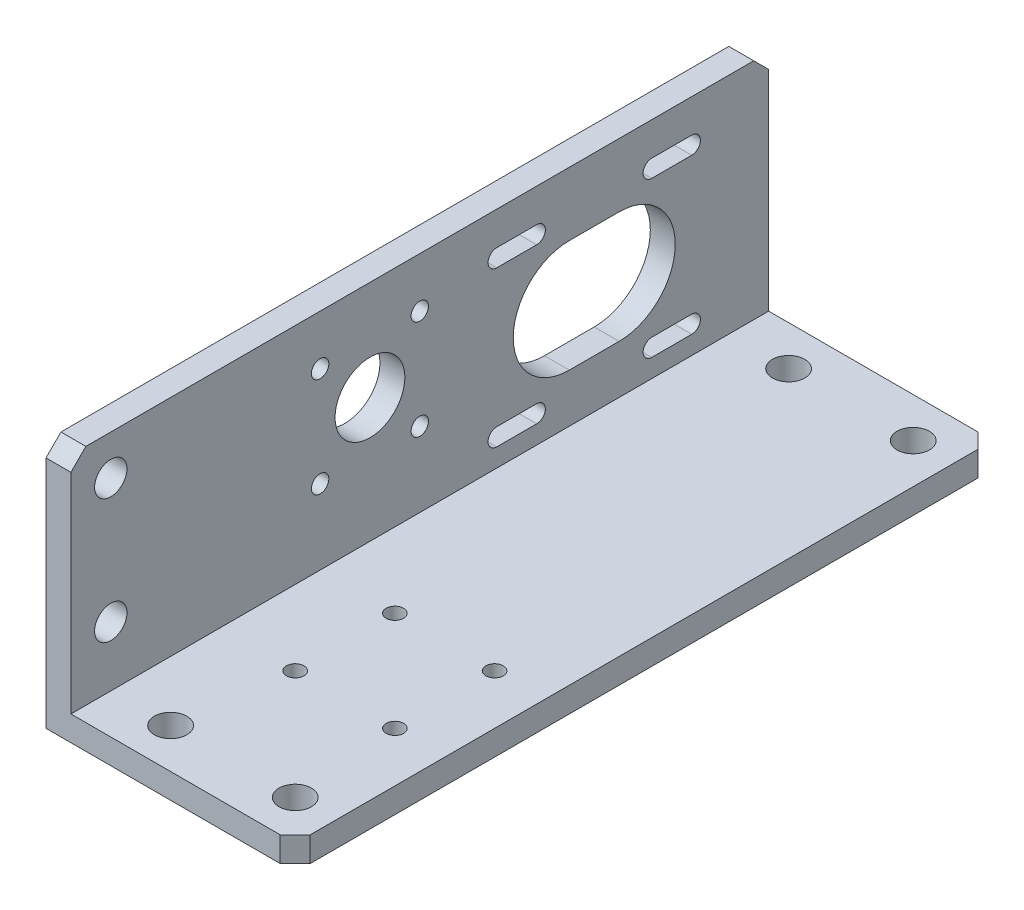
from build123d import *

# Parameters (mm, degrees)
ESTRUSIONE_ESTRUSIONE1_DEPTH = 140
FORO_6_5_6_5_1_D             = 6.5
FORO_6_5_6_5_2_D             = 6.5
FORO_6_5_6_5_2_DEPTH         = 5
FORO_6_5_6_5_2_TIP           = 1.952797012
TAGLIO_ESTRUSIONE3_REACH     = 158.844
SCHIZZO10_R                  = 1.75
SCHIZZO10_R_2                = 7
TAGLIO_ESTRUSIONE4_REACH     = 158.844
SCHIZZO11_R                  = 1.75
TAGLIO_ESTRUSIONE6_REACH     = 158.844
SMUSSO1_SIZE                 = 3


with BuildPart() as part:
    # Schizzo1 → Estrusione-Estrusione1 (new body)
    with BuildSketch(Plane.XY):
        Polygon((0, 0), (0, 50), (5, 50), (5, 5), (50, 5), (50, 0), align=None)
    extrude(amount=ESTRUSIONE_ESTRUSIONE1_DEPTH)

    # Foro Ø6.5 (6.5)-1 (through all)
    with Locations(Plane(origin=(0, 0, 0), x_dir=(-1, 0, 0), z_dir=(0, -1, 0))):
        with Locations((-17, -132), (-42, -132)):
            foro_6_5_6_5_1 = Hole(FORO_6_5_6_5_1_D / 2)

    # Foro Ø6.5 (6.5)-2
    with Locations(Plane.ZY):
        with Locations((132, 42), (132, 17)):
            Hole(FORO_6_5_6_5_2_D / 2, depth=FORO_6_5_6_5_2_DEPTH)
            with Locations((0, 0, -(FORO_6_5_6_5_2_DEPTH + FORO_6_5_6_5_2_TIP / 2))):  # 118° drill point
                Cone(0, FORO_6_5_6_5_2_D / 2, FORO_6_5_6_5_2_TIP, mode=Mode.SUBTRACT)

    # Specchia1: Foro Ø6.5 (6.5)-1 across plane
    add(foro_6_5_6_5_1.mirror(Plane.XY.offset(70)), mode=Mode.SUBTRACT)

    # Schizzo10 → Taglio-Estrusione3 (cut, up to next)
    with BuildSketch(Plane.ZY, mode=Mode.PRIVATE) as taglio_estrusione3_sk1:
        with Locations((70, 40)):
            Circle(SCHIZZO10_R)
    taglio_estrusione3_tool1 = extrude(taglio_estrusione3_sk1.sketch, amount=-TAGLIO_ESTRUSIONE3_REACH, mode=Mode.PRIVATE) & part.part
    # Schizzo10 → Taglio-Estrusione3 (cut, up to next)
    with BuildSketch(Plane.ZY, mode=Mode.PRIVATE) as taglio_estrusione3_sk2:
        with Locations((90, 40)):
            Circle(SCHIZZO10_R)
    taglio_estrusione3_tool2 = extrude(taglio_estrusione3_sk2.sketch, amount=-TAGLIO_ESTRUSIONE3_REACH, mode=Mode.PRIVATE) & part.part
    # Schizzo10 → Taglio-Estrusione3 (cut, up to next)
    with BuildSketch(Plane.ZY, mode=Mode.PRIVATE) as taglio_estrusione3_sk3:
        with Locations((90, 20)):
            Circle(SCHIZZO10_R)
    taglio_estrusione3_tool3 = extrude(taglio_estrusione3_sk3.sketch, amount=-TAGLIO_ESTRUSIONE3_REACH, mode=Mode.PRIVATE) & part.part
    # Schizzo10 → Taglio-Estrusione3 (cut, up to next)
    with BuildSketch(Plane.ZY, mode=Mode.PRIVATE) as taglio_estrusione3_sk4:
        with Locations((70, 20)):
            Circle(SCHIZZO10_R)
    taglio_estrusione3_tool4 = extrude(taglio_estrusione3_sk4.sketch, amount=-TAGLIO_ESTRUSIONE3_REACH, mode=Mode.PRIVATE) & part.part
    # Schizzo10 → Taglio-Estrusione3 (cut, up to next)
    with BuildSketch(Plane.ZY, mode=Mode.PRIVATE) as taglio_estrusione3_sk5:
        with Locations((80, 30)):
            Circle(SCHIZZO10_R_2)
    taglio_estrusione3_tool5 = extrude(taglio_estrusione3_sk5.sketch, amount=-TAGLIO_ESTRUSIONE3_REACH, mode=Mode.PRIVATE) & part.part
    add(taglio_estrusione3_tool1.solids().sort_by_distance((0, 40, 70))[0], mode=Mode.SUBTRACT)
    add(taglio_estrusione3_tool2.solids().sort_by_distance((0, 40, 90))[0], mode=Mode.SUBTRACT)
    add(taglio_estrusione3_tool3.solids().sort_by_distance((0, 20, 90))[0], mode=Mode.SUBTRACT)
    add(taglio_estrusione3_tool4.solids().sort_by_distance((0, 20, 70))[0], mode=Mode.SUBTRACT)
    add(taglio_estrusione3_tool5.solids().sort_by_distance((0, 30, 80))[0], mode=Mode.SUBTRACT)

    # Schizzo11 → Taglio-Estrusione4 (cut, up to next)
    with BuildSketch(Plane.XZ, mode=Mode.PRIVATE) as taglio_estrusione4_sk1:
        with Locations((20, 90)):
            Circle(SCHIZZO11_R)
    taglio_estrusione4_tool1 = extrude(taglio_estrusione4_sk1.sketch, amount=-TAGLIO_ESTRUSIONE4_REACH, mode=Mode.PRIVATE) & part.part
    # Schizzo11 → Taglio-Estrusione4 (cut, up to next)
    with BuildSketch(Plane.XZ, mode=Mode.PRIVATE) as taglio_estrusione4_sk2:
        with Locations((20, 110)):
            Circle(SCHIZZO11_R)
    taglio_estrusione4_tool2 = extrude(taglio_estrusione4_sk2.sketch, amount=-TAGLIO_ESTRUSIONE4_REACH, mode=Mode.PRIVATE) & part.part
    # Schizzo11 → Taglio-Estrusione4 (cut, up to next)
    with BuildSketch(Plane.XZ, mode=Mode.PRIVATE) as taglio_estrusione4_sk3:
        with Locations((40, 110)):
            Circle(SCHIZZO11_R)
    taglio_estrusione4_tool3 = extrude(taglio_estrusione4_sk3.sketch, amount=-TAGLIO_ESTRUSIONE4_REACH, mode=Mode.PRIVATE) & part.part
    # Schizzo11 → Taglio-Estrusione4 (cut, up to next)
    with BuildSketch(Plane.XZ, mode=Mode.PRIVATE) as taglio_estrusione4_sk4:
        with Locations((40, 90)):
            Circle(SCHIZZO11_R)
    taglio_estrusione4_tool4 = extrude(taglio_estrusione4_sk4.sketch, amount=-TAGLIO_ESTRUSIONE4_REACH, mode=Mode.PRIVATE) & part.part
    add(taglio_estrusione4_tool1.solids().sort_by_distance((20, 0, 90))[0], mode=Mode.SUBTRACT)
    add(taglio_estrusione4_tool2.solids().sort_by_distance((20, 0, 110))[0], mode=Mode.SUBTRACT)
    add(taglio_estrusione4_tool3.solids().sort_by_distance((40, 0, 110))[0], mode=Mode.SUBTRACT)
    add(taglio_estrusione4_tool4.solids().sort_by_distance((40, 0, 90))[0], mode=Mode.SUBTRACT)

    # Schizzo13 → Taglio-Estrusione6 (cut, up to next)
    with BuildSketch(Plane.ZY, mode=Mode.PRIVATE) as taglio_estrusione6_sk1:
        with BuildLine():
            Line((15.443650814, 43.306349186), (23.443650814, 43.306349186))
            ThreePointArc((23.443650814, 43.306349186), (25.193650814, 41.556349186), (23.443650814, 39.806349186))
            Line((23.443650814, 39.806349186), (15.443650814, 39.806349186))
            ThreePointArc((15.443650814, 39.806349186), (13.693650814, 41.556349186), (15.443650814, 43.306349186))
        make_face()
    taglio_estrusione6_tool1 = extrude(taglio_estrusione6_sk1.sketch, amount=-TAGLIO_ESTRUSIONE6_REACH, mode=Mode.PRIVATE) & part.part
    # Schizzo13 → Taglio-Estrusione6 (cut, up to next)
    with BuildSketch(Plane.ZY, mode=Mode.PRIVATE) as taglio_estrusione6_sk2:
        with BuildLine():
            Line((15.443650814, 8.693650814), (23.443650814, 8.693650814))
            ThreePointArc((23.443650814, 8.693650814), (25.193650814, 10.443650814), (23.443650814, 12.193650814))
            Line((23.443650814, 12.193650814), (15.443650814, 12.193650814))
            ThreePointArc((15.443650814, 12.193650814), (13.693650814, 10.443650814), (15.443650814, 8.693650814))
        make_face()
    taglio_estrusione6_tool2 = extrude(taglio_estrusione6_sk2.sketch, amount=-TAGLIO_ESTRUSIONE6_REACH, mode=Mode.PRIVATE) & part.part
    # Schizzo13 → Taglio-Estrusione6 (cut, up to next)
    with BuildSketch(Plane.ZY, mode=Mode.PRIVATE) as taglio_estrusione6_sk3:
        with BuildLine():
            Line((54.556349186, 43.306349186), (46.556349186, 43.306349186))
            ThreePointArc((46.556349186, 43.306349186), (44.806349186, 41.556349186), (46.556349186, 39.806349186))
            Line((46.556349186, 39.806349186), (54.556349186, 39.806349186))
            ThreePointArc((54.556349186, 39.806349186), (56.306349186, 41.556349186), (54.556349186, 43.306349186))
        make_face()
    taglio_estrusione6_tool3 = extrude(taglio_estrusione6_sk3.sketch, amount=-TAGLIO_ESTRUSIONE6_REACH, mode=Mode.PRIVATE) & part.part
    # Schizzo13 → Taglio-Estrusione6 (cut, up to next)
    with BuildSketch(Plane.ZY, mode=Mode.PRIVATE) as taglio_estrusione6_sk4:
        with BuildLine():
            Line((54.556349186, 8.693650814), (46.556349186, 8.693650814))
            ThreePointArc((46.556349186, 8.693650814), (44.806349186, 10.443650814), (46.556349186, 12.193650814))
            Line((46.556349186, 12.193650814), (54.556349186, 12.193650814))
            ThreePointArc((54.556349186, 12.193650814), (56.306349186, 10.443650814), (54.556349186, 8.693650814))
        make_face()
    taglio_estrusione6_tool4 = extrude(taglio_estrusione6_sk4.sketch, amount=-TAGLIO_ESTRUSIONE6_REACH, mode=Mode.PRIVATE) & part.part
    # Schizzo13 → Taglio-Estrusione6 (cut, up to next)
    with BuildSketch(Plane.ZY, mode=Mode.PRIVATE) as taglio_estrusione6_sk5:
        with BuildLine():
            Line((40, 14.75), (30, 14.75))
            ThreePointArc((30, 14.75), (18.75, 26), (30, 37.25))
            Line((30, 37.25), (40, 37.25))
            ThreePointArc((40, 37.25), (51.25, 26), (40, 14.75))
        make_face()
    taglio_estrusione6_tool5 = extrude(taglio_estrusione6_sk5.sketch, amount=-TAGLIO_ESTRUSIONE6_REACH, mode=Mode.PRIVATE) & part.part
    add(taglio_estrusione6_tool1.solids().sort_by_distance((0, 41.556349, 19.443651))[0], mode=Mode.SUBTRACT)
    add(taglio_estrusione6_tool2.solids().sort_by_distance((0, 10.443651, 19.443651))[0], mode=Mode.SUBTRACT)
    add(taglio_estrusione6_tool3.solids().sort_by_distance((0, 41.556349, 50.556349))[0], mode=Mode.SUBTRACT)
    add(taglio_estrusione6_tool4.solids().sort_by_distance((0, 10.443651, 50.556349))[0], mode=Mode.SUBTRACT)
    add(taglio_estrusione6_tool5.solids().sort_by_distance((0, 26, 35))[0], mode=Mode.SUBTRACT)

    # Smusso1
    smusso1_edges = [part.edges().sort_by_distance(p)[0] for p in [
        (50, 2.5, 0),
        (2.5, 50, 0),
        (50, 2.5, 140),
        (2.5, 50, 140),
    ]]
    chamfer(smusso1_edges, length=SMUSSO1_SIZE)


solid = part.part
